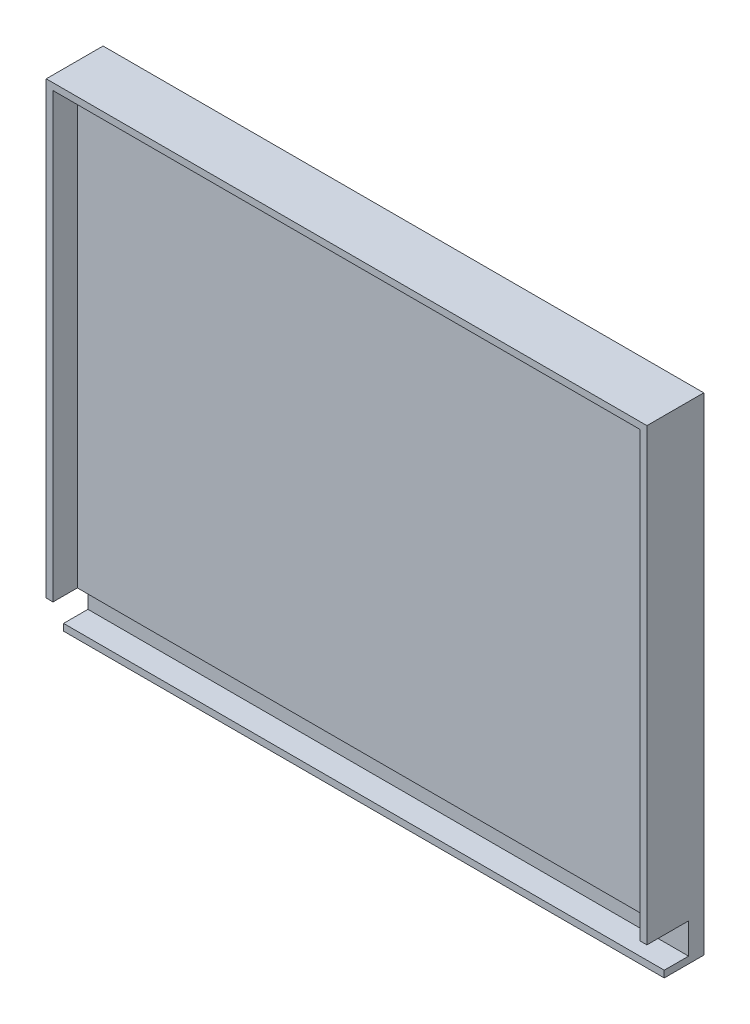
from build123d import *

# Parameters (mm, degrees)
SKETCH1_W            = 281.94
SKETCH1_H            = 228.6
BOSS_EXTRUDE2_DEPTH  = 25.4
SKETCH3_W            = 281.94
SKETCH3_H            = 17.526
CUT_EXTRUDE1_DEPTH   = 8.128
SKETCH4_W            = 11.43
SKETCH4_H            = 211.074
BOSS_EXTRUDE4_DEPTH  = 3.175
SKETCH5_W            = 278.765
SKETCH5_H            = 11.43
BOSS_EXTRUDE9_DEPTH  = 3.175
SKETCH9_W            = 11.43
SKETCH9_H            = 207.899
BOSS_EXTRUDE10_DEPTH = 3.175
SKETCH8_W            = 281.94
SKETCH8_H            = 11.43
BOSS_EXTRUDE11_DEPTH = 3.175
SKETCH10_W           = 281.94
SKETCH10_H           = 14.351
CUT_EXTRUDE2_DEPTH   = 10.16
SKETCH11_W           = 275.59
SKETCH11_H           = 207.899
CUT_EXTRUDE3_DEPTH   = 10.16
CUT_EXTRUDE4_DEPTH   = 10.16
SKETCH13_W           = 281.94
SKETCH13_H           = 3.175
CUT_EXTRUDE5_DEPTH   = 10.16
SHELL4_START         = -65.823170732
SHELL4_DEPTH         = 276.86


# Read off the part's stored shape, not the designer's step: Shell4
with BuildPart() as part:
    # Sketch1 → Boss-Extrude2 (new body)
    with BuildSketch(Plane.XY):
        with Locations((72.606829268, 16.339634146)):
            Rectangle(SKETCH1_W, SKETCH1_H)
    extrude(amount=BOSS_EXTRUDE2_DEPTH)

    # Sketch3 → Cut-Extrude1 (cut)
    with BuildSketch(Plane.XY.offset(25.4)):
        with Locations((72.606829268, -89.197365854)):
            Rectangle(SKETCH3_W, SKETCH3_H)
    extrude(amount=-CUT_EXTRUDE1_DEPTH, mode=Mode.SUBTRACT)



with BuildPart() as body_2:
    # Sketch4 → Boss-Extrude4 (new body)
    with BuildSketch(Plane.ZY.offset(68.363170732)):
        with Locations((31.115, 25.102634146)):
            Rectangle(SKETCH4_W, SKETCH4_H)
    extrude(amount=-BOSS_EXTRUDE4_DEPTH)


with BuildPart() as part_1:
    add(part.part)

    add(body_2.part)  # Boss-Extrude9 merges body 2
    # Sketch5 → Boss-Extrude9 (add)
    with BuildSketch(Plane(origin=(0, 130.639634146, 0), x_dir=(1, 0, 0), z_dir=(0, 1, 0))):
        with Locations((74.194329268, -31.115)):
            Rectangle(SKETCH5_W, SKETCH5_H)
    extrude(amount=-BOSS_EXTRUDE9_DEPTH)

    # Sketch9 → Boss-Extrude10 (add)
    with BuildSketch(Plane(origin=(213.576829268, 0, 0), x_dir=(0, 0, -1), z_dir=(1, 0, 0))):
        with Locations((-31.115, 23.515134146)):
            Rectangle(SKETCH9_W, SKETCH9_H)
    extrude(amount=-BOSS_EXTRUDE10_DEPTH)


with BuildPart() as body_2_2:
    # Sketch8 → Boss-Extrude11 (new body)
    with BuildSketch(Plane.XZ.offset(97.960365854)):
        with Locations((72.606829268, 22.987)):
            Rectangle(SKETCH8_W, SKETCH8_H)
    extrude(amount=-BOSS_EXTRUDE11_DEPTH)

    # Combine1: union part
    add(part_1.part)

    # Sketch10 → Cut-Extrude2 (cut)
    with BuildSketch(Plane.XY.offset(17.272)):
        with Locations((72.606829268, -87.609865854)):
            Rectangle(SKETCH10_W, SKETCH10_H)
    extrude(amount=-CUT_EXTRUDE2_DEPTH, mode=Mode.SUBTRACT)

    # Sketch11 → Cut-Extrude3 (cut)
    with BuildSketch(Plane.XY.offset(25.4)):
        with Locations((72.606829268, 23.515134146)):
            Rectangle(SKETCH11_W, SKETCH11_H)
    extrude(amount=-CUT_EXTRUDE3_DEPTH, mode=Mode.SUBTRACT)

    # Sketch12 → Cut-Extrude4 (cut)
    with BuildSketch(Plane.XY.offset(36.83)):
        Polygon((-68.363170732, -80.434365854), (-65.188170732, -80.434365854), (-65.188170732, 127.464634146), (210.401829268, 127.464634146), (210.401829268, -80.434365854), (213.576829268, -80.434365854), (213.576829268, 130.639634146), (-68.363170732, 130.639634146), align=None)
    extrude(amount=-CUT_EXTRUDE4_DEPTH, mode=Mode.SUBTRACT)

    # Sketch13 → Cut-Extrude5 (cut)
    with BuildSketch(Plane.XY.offset(28.702)):
        with Locations((72.606829268, -96.372865854)):
            Rectangle(SKETCH13_W, SKETCH13_H)
    extrude(amount=-CUT_EXTRUDE5_DEPTH, mode=Mode.SUBTRACT)

    # Shell4 outline → Shell4 (cut)
    with BuildSketch(Plane.YZ.offset(SHELL4_START)):
        Polygon((-95.420365854, 4.572), (-95.420365854, 2.54), (128.099634146, 2.54), (128.099634146, 12.7), (-77.894365854, 12.7), (-77.894365854, 4.572), align=None)
    extrude(amount=SHELL4_DEPTH, mode=Mode.SUBTRACT)


solid = body_2_2.part
